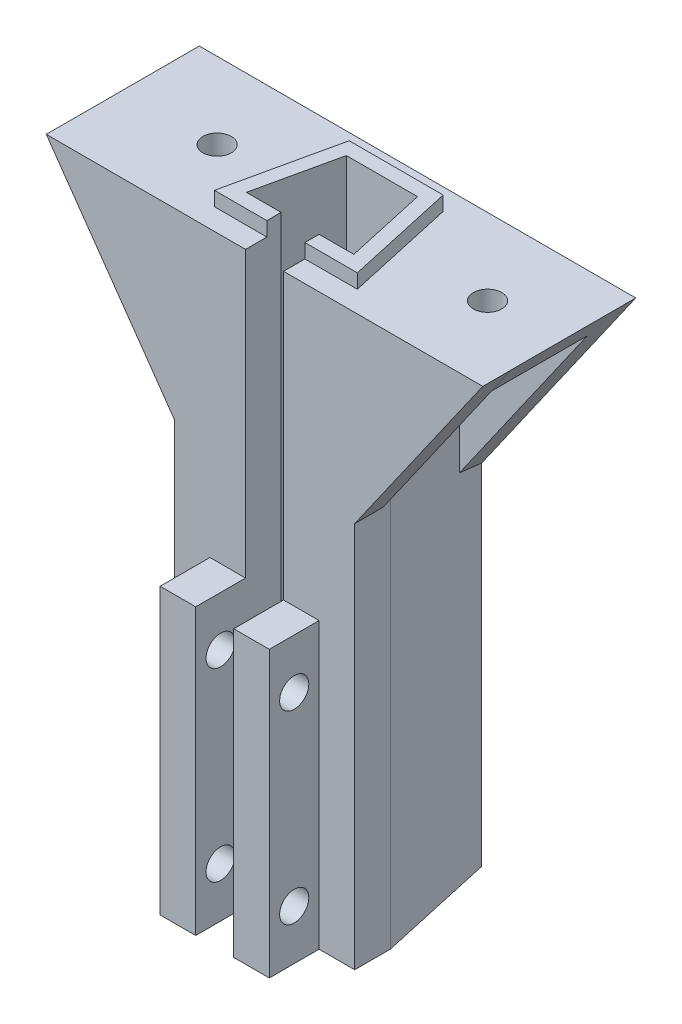
from build123d import *

# Parameters (mm, degrees)
BOSS_EXTRUDE1_DEPTH = 40
SKETCH3_R           = 2.05
CUT_EXTRUDE2_DEPTH  = 40
BOSS_EXTRUDE2_DEPTH = 40
SKETCH7_W           = 3.5
SKETCH7_H           = 1.2
CUT_EXTRUDE3_DEPTH  = 87.11081163
SKETCH8_W           = 1
SKETCH8_H           = 1.2
CUT_EXTRUDE4_DEPTH  = 5
BOSS_EXTRUDE3_DEPTH = 2
SKETCH10_W          = 2
SKETCH10_H          = 1.2
CUT_EXTRUDE5_DEPTH  = 11
BOSS_EXTRUDE4_DEPTH = 4
BOSS_EXTRUDE7_DEPTH = 4
BOSS_EXTRUDE8_DEPTH = 19
SKETCH17_R          = 2
CUT_EXTRUDE7_DEPTH  = 19


with BuildPart() as part:
    # Sketch2 → Boss-Extrude1 (new body)
    with BuildSketch(Plane(origin=(0, 0, 0), x_dir=(1, 0, 0), z_dir=(0, 1, 0))):
        Polygon((7.442255773, 6.343580014), (-10.583592744, 6.343580014), (-14.241554677, -10.156419986), (-14.241554677, -15.156419986), (-9.241554677, -15.156419986), (-9.241554677, -22.156419986), (-4.241554677, -22.156419986), (-4.241554677, -10.156419986), (-9.120157106, -10.156419986), (-6.570668485, 1.343580014), (3.429331515, 1.343580014), (5.978820135, -10.156419986), (1.100217707, -10.156419986), (1.100217707, -22.156419986), (6.100217707, -22.156419986), (6.100217707, -15.156419986), (11.100217707, -15.156419986), (11.100217707, -10.156419986), align=None)
    extrude(amount=BOSS_EXTRUDE1_DEPTH)

    # Sketch3 → Cut-Extrude2 (cut)
    with BuildSketch(Plane.ZY.offset(9.241554677)):
        with Locations((18.656419986, 33)):
            Circle(SKETCH3_R)
        with Locations((18.656419986, 7)):
            Circle(SKETCH3_R)
    extrude(amount=-CUT_EXTRUDE2_DEPTH, mode=Mode.SUBTRACT)

    # Sketch4 → Boss-Extrude2 (add)
    with BuildSketch(Plane(origin=(0, 40, 0), x_dir=(1, 0, 0), z_dir=(0, 1, 0))):
        Polygon((-4.241554677, -10.156419986), (-9.120157106, -10.156419986), (-6.570668485, 1.343580014), (3.429331515, 1.343580014), (5.978820135, -10.156419986), (1.100217707, -10.156419986), (1.100217707, -15.156419986), (6.100217707, -15.156419986), (11.100217707, -15.156419986), (11.100217707, -10.156419986), (7.442255773, 6.343580014), (-10.583592744, 6.343580014), (-14.241554677, -10.156419986), (-14.241554677, -15.156419986), (-9.241554677, -15.156419986), (-4.241554677, -15.156419986), align=None)
    extrude(amount=BOSS_EXTRUDE2_DEPTH)

    # Sketch7 → Cut-Extrude3 (cut, through all)
    with BuildSketch(Plane(origin=(0, 0, -6.343580014), x_dir=(-1, 0, 0), z_dir=(0, 0, -1))):
        with Locations((1.570244227, 3.8)):
            Rectangle(SKETCH7_W, SKETCH7_H)
    extrude(amount=-CUT_EXTRUDE3_DEPTH, mode=Mode.SUBTRACT)

    # Sketch8 → Cut-Extrude4 (cut)
    with BuildSketch(Plane(origin=(0, 0, 10.156419986), x_dir=(-1, 0, 0), z_dir=(0, 0, -1))):
        with Locations((4.741554677, 3.8)):
            Rectangle(SKETCH8_W, SKETCH8_H)
    extrude(amount=-CUT_EXTRUDE4_DEPTH, mode=Mode.SUBTRACT)

    # Sketch9 → Boss-Extrude3 (add)
    with BuildSketch(Plane(origin=(0, 80, 0), x_dir=(1, 0, 0), z_dir=(0, 1, 0))):
        Polygon((1.100217707, -10.156419986), (1.100217707, -12.156419986), (8.470768489, -12.156419986), (5.034501218, 3.343580014), (-8.175838189, 3.343580014), (-11.61210546, -12.156419986), (-4.241554677, -12.156419986), (-4.241554677, -10.156419986), (-9.120157106, -10.156419986), (-6.570668485, 1.343580014), (3.429331515, 1.343580014), (5.978820135, -10.156419986), align=None)
    extrude(amount=BOSS_EXTRUDE3_DEPTH)

    # Sketch10 → Cut-Extrude5 (cut)
    with BuildSketch(Plane(origin=(-5.241554677, 0, 0), x_dir=(0, 0, -1), z_dir=(1, 0, 0))):
        with Locations((-14.156419986, 3.8)):
            Rectangle(SKETCH10_W, SKETCH10_H)
    extrude(amount=-CUT_EXTRUDE5_DEPTH, mode=Mode.SUBTRACT)

    # Sketch11 → Boss-Extrude4 (add)
    with BuildSketch(Plane.XY.offset(15.156419986)):
        Polygon((11.100217707, 54.293335879), (29.100217707, 80), (11.100217707, 80), align=None)
        Polygon((-14.241554677, 54.293335879), (-32.241554677, 80), (-14.241554677, 80), align=None)
    extrude(amount=-BOSS_EXTRUDE4_DEPTH)

    # Sketch15 → Boss-Extrude7 (add)
    with BuildSketch(Plane(origin=(0, 0, -6.343580014), x_dir=(-1, 0, 0), z_dir=(0, 0, -1))):
        Polygon((-7.442255773, 80), (-7.442255773, 49.080595654), (-29.092255773, 80), align=None)
        Polygon((10.583592744, 80), (10.583592744, 49.080595654), (32.233592744, 80), align=None)
    extrude(amount=-BOSS_EXTRUDE7_DEPTH)

    # Sketch16 → Boss-Extrude8 (add)
    with BuildSketch(Plane(origin=(0, 0, -6.343580014), x_dir=(-1, 0, 0), z_dir=(0, 0, -1))):
        Polygon((32.233592744, 80), (29.432762591, 76), (10.233592744, 76), (10.233592744, 80), align=None)
        Polygon((-29.092255773, 80), (-26.29142562, 76), (-7.092255773, 76), (-7.092255773, 80), align=None)
    extrude(amount=-BOSS_EXTRUDE8_DEPTH)

    # Sketch17 → Cut-Extrude7 (cut)
    with BuildSketch(Plane(origin=(0, 76, 0), x_dir=(-1, 0, 0), z_dir=(0, -1, 0))):
        with Locations((-19.01946661, -4.406419986)):
            Circle(SKETCH17_R)
        with Locations((18.980533391, -4.406419986)):
            Circle(SKETCH17_R)
    extrude(amount=-CUT_EXTRUDE7_DEPTH, mode=Mode.SUBTRACT)


solid = part.part
